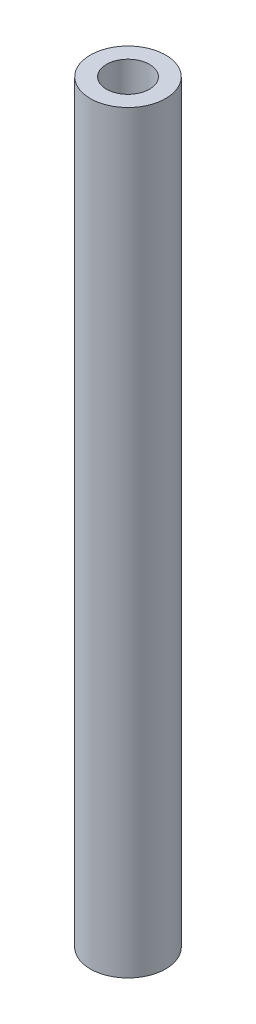
from build123d import *

# Parameters (mm, degrees)
SKETCH1_R           = 1.75
SKETCH1_R_2         = 1
BOSS_EXTRUDE1_DEPTH = 17.5


with BuildPart() as part:
    # Sketch1 → Boss-Extrude1 (new, symmetric)
    with BuildSketch(Plane(origin=(0, 0, 0), x_dir=(1, 0, 0), z_dir=(0, 1, 0))):
        Circle(SKETCH1_R)
        Circle(SKETCH1_R_2, mode=Mode.SUBTRACT)
    extrude(amount=BOSS_EXTRUDE1_DEPTH, both=True)


solid = part.part
